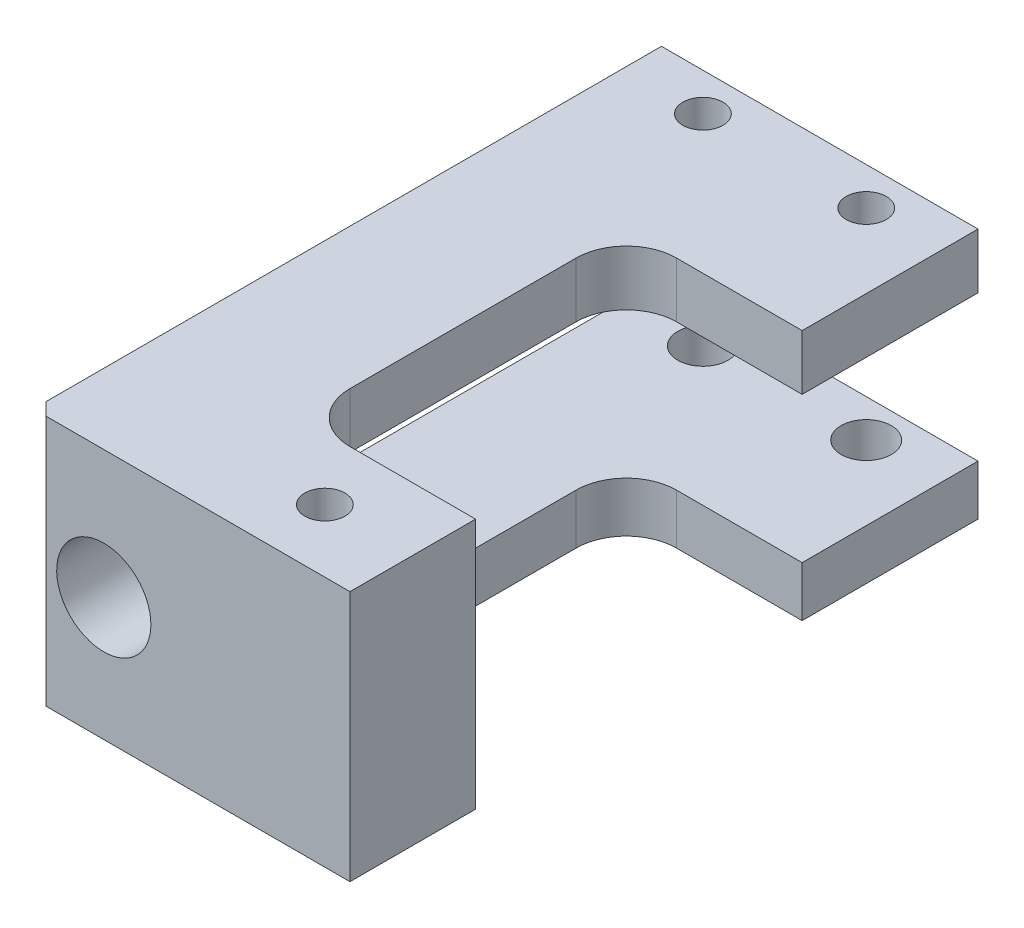
from build123d import *

# Parameters (mm, degrees)
SKETCH1_W                   = 12.6
SKETCH1_H                   = 25
BOSS_EXTRUDE1_DEPTH         = 10
CUT_EXTRUDE9_START          = -5
SKETCH14_W                  = 7
SKETCH14_H                  = 5.8
CUT_EXTRUDE9_DEPTH          = 20
SKETCH15_W                  = 20
SKETCH15_H                  = 5.8
CUT_EXTRUDE10_DEPTH         = 18.47140521
CUT_EXTRUDE11_DEPTH         = 17.122654868
CUT_EXTRUDE11_DEPTH_BACK    = 17.122654868
SKETCH17_W                  = 7
SKETCH17_H                  = 13
SKETCH18_R                  = 1.875
CUT_EXTRUDE12_DEPTH         = 24.231228982
FILLET2_R                   = 2
SKETCH20_R                  = 1
CUT_EXTRUDE18_DEPTH         = 5
TAP_DRILL_FOR_M2X0_4_TAP2_D = 1.6
TAP_DRILL_FOR_M2X0_4_TAP3_D = 1.6
FILLET4_R                   = 0.2
CHAMFER1_SIZE               = 0.5
SKETCH26_R                  = 1.5
CUT_EXTRUDE20_DEPTH         = 1


with BuildPart() as part:
    # Sketch1 → Boss-Extrude1 (new body)
    with BuildSketch(Plane(origin=(0, 0, 0), x_dir=(1, 0, 0), z_dir=(0, 1, 0))):
        Rectangle(SKETCH1_W, SKETCH1_H)
    extrude(amount=BOSS_EXTRUDE1_DEPTH)

    # Sketch14 → Cut-Extrude9 (cut)
    with BuildSketch(Plane.XY.offset(12.5).offset(CUT_EXTRUDE9_START)):
        with Locations((2.8, 4.9)):
            Rectangle(SKETCH14_W, SKETCH14_H)
    extrude(amount=-CUT_EXTRUDE9_DEPTH, mode=Mode.SUBTRACT)

    # Sketch15 → Cut-Extrude10 (cut, through all)
    with BuildSketch(Plane(origin=(-0.7, 0, 0), x_dir=(0, 0, -1), z_dir=(1, 0, 0))):
        with Locations((2.5, 4.9)):
            Rectangle(SKETCH15_W, SKETCH15_H)
    extrude(amount=-CUT_EXTRUDE10_DEPTH, mode=Mode.SUBTRACT)

    # Sketch17 → Cut-Extrude11 (cut, two sides: drawn at the far end of the back side and taken through both)
    with BuildSketch(Plane(origin=(0, 2, 0), x_dir=(1, 0, 0), z_dir=(0, 1, 0)).offset(-CUT_EXTRUDE11_DEPTH_BACK)):
        with Locations((2.8, -1)):
            Rectangle(SKETCH17_W, SKETCH17_H)
    extrude(amount=CUT_EXTRUDE11_DEPTH + CUT_EXTRUDE11_DEPTH_BACK, mode=Mode.SUBTRACT)

    # Sketch18 → Cut-Extrude12 (cut, through all)
    with BuildSketch(Plane(origin=(0, 0, 7.5), x_dir=(-1, 0, 0), z_dir=(0, 0, -1))):
        with Locations((3.5, 4.9)):
            Circle(SKETCH18_R)
    extrude(amount=-CUT_EXTRUDE12_DEPTH, mode=Mode.SUBTRACT)

    # Fillet2
    fillet2_edges = [part.edges().sort_by_distance(p)[0] for p in [
        (-0.7, 8.9, -5.5),
        (-0.7, 1, -5.5),
        (-0.7, 1, 7.5),
        (-0.7, 8.9, 7.5),
    ]]
    fillet(fillet2_edges, radius=FILLET2_R)

    # Sketch20 → Cut-Extrude18 (cut)
    with BuildSketch(Plane.XZ):
        with Locations((3.35, -11)):
            Circle(SKETCH20_R)
        with Locations((-3.15, -11)):
            Circle(SKETCH20_R)
    extrude(amount=-CUT_EXTRUDE18_DEPTH, mode=Mode.SUBTRACT)

    # Tap Drill for M2x0.4 Tap2 (through all)
    with Locations(Plane(origin=(3.35, 10, -11), x_dir=(0, 0, 1), z_dir=(0, 1, 0))):
        with Locations((0, 0), (0, -6.5)):
            Hole(TAP_DRILL_FOR_M2X0_4_TAP2_D / 2)

    # Tap Drill for M2x0.4 Tap3 (through all)
    with Locations(Plane(origin=(2.8, 10, 10), x_dir=(0, 0, 1), z_dir=(0, 1, 0))):
        with Locations((0, 0)):
            Hole(TAP_DRILL_FOR_M2X0_4_TAP3_D / 2)

    # Fillet4
    fillet4_edges = [part.edges().sort_by_distance(p)[0] for p in [
        (-2.5, 7.8, 7.5),
        (-2.5, 2, 7.5),
    ]]
    fillet(fillet4_edges, radius=FILLET4_R)

    # Chamfer1
    chamfer1_edges = [part.edges().sort_by_distance(p)[0] for p in [
        (-6.3, 5, 12.5),
    ]]
    chamfer(chamfer1_edges, length=CHAMFER1_SIZE)

    # Sketch26 → Cut-Extrude20 (cut)
    with BuildSketch(Plane.XZ):
        with Locations((2.8, 10)):
            Circle(SKETCH26_R)
    extrude(amount=-CUT_EXTRUDE20_DEPTH, mode=Mode.SUBTRACT)


solid = part.part
